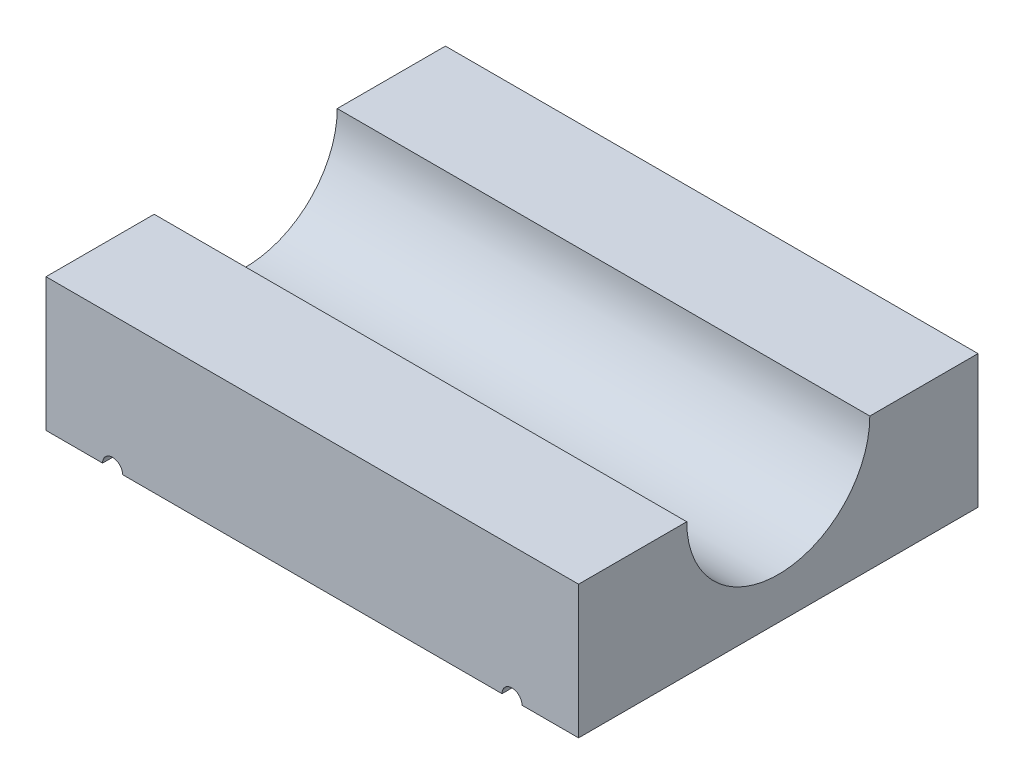
from build123d import *

# Parameters (mm, degrees)
BOSS_EXTRUDE2_DEPTH = 101.6
SKETCH4_R           = 1.905
CUT_EXTRUDE1_DEPTH  = 130.515095645


with BuildPart() as part:
    # Sketch3 → Boss-Extrude2 (new body)
    with BuildSketch(Plane(origin=(0, 0, 0), x_dir=(0, 0, -1), z_dir=(1, 0, 0))):
        with BuildLine():
            Line((55.5625, 25.4), (76.2, 25.4))
            Line((76.2, 25.4), (76.2, 0))
            Line((76.2, 0), (0, 0))
            Line((0, 0), (0, 25.4))
            Line((0, 25.4), (20.6375, 25.4))
            ThreePointArc((20.6375, 25.4), (38.1, 7.9375), (55.5625, 25.4))
        make_face()
    extrude(amount=BOSS_EXTRUDE2_DEPTH)

    # Sketch4 → Cut-Extrude1 (cut, through all)
    with BuildSketch(Plane.XY):
        with Locations((12.7, 0)):
            Circle(SKETCH4_R)
        with Locations((88.9, 0)):
            Circle(SKETCH4_R)
    extrude(amount=-CUT_EXTRUDE1_DEPTH, mode=Mode.SUBTRACT)


solid = part.part
